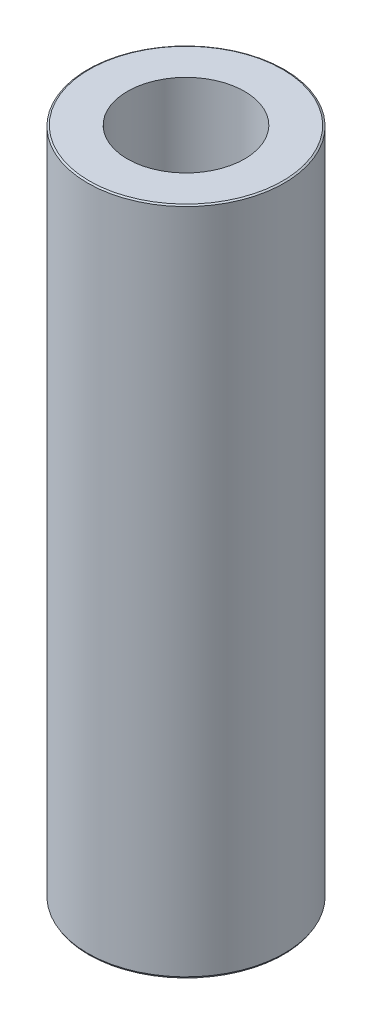
from build123d import *
from OCP.BRepFilletAPI import BRepFilletAPI_MakeChamfer

# Parameters (mm, degrees)
SKETCH1_R           = 42.5
BOSS_EXTRUDE1_DEPTH = 289.378602009
SKETCH2_R           = 25.323627817
CUT_EXTRUDE1_DEPTH  = 296.554521706
CHAMFER1_SIZE       = 0.420189699
CHAMFER1_SIZE2      = 0.727789907


with BuildPart() as part:
    # Sketch1 → Boss-Extrude1 (new body)
    with BuildSketch(Plane(origin=(0, 0, 0), x_dir=(1, 0, 0), z_dir=(0, 1, 0))):
        Circle(SKETCH1_R)
    extrude(amount=BOSS_EXTRUDE1_DEPTH)

    # Sketch2 → Cut-Extrude1 (cut, through all)
    with BuildSketch(Plane(origin=(0, 0, 0), x_dir=(1, 0, 0), z_dir=(0, 1, 0))):
        Circle(SKETCH2_R)
    extrude(amount=CUT_EXTRUDE1_DEPTH, mode=Mode.SUBTRACT)

    # Chamfer1: one chamfer whose edges measure the first distance from different faces: ONE call of the kernel's chamfer builder (chamfer() names one face for all edges)
    chamfer1_edges_1 = [part.edges().sort_by_distance(p)[0] for p in [
        (-42.5, 289.378602009, 0),
    ]]
    chamfer1_side_1 = [part.faces().sort_by_distance(p)[0] for p in [
        (-42.5, 144.689301005, 0),
    ]]
    chamfer1_edges_2 = [part.edges().sort_by_distance(p)[0] for p in [
        (-42.5, 0, 0),
    ]]
    chamfer1_side_2 = [part.faces().sort_by_distance(p)[0] for p in [
        (-41.297918472, 0, 0),
    ]]
    chamfer1 = BRepFilletAPI_MakeChamfer(part.part.solid().wrapped)
    for e in chamfer1_edges_1:
        chamfer1.Add(CHAMFER1_SIZE, CHAMFER1_SIZE2, e.wrapped, chamfer1_side_1[0].wrapped)  # the first distance lies on this face
    for e in chamfer1_edges_2:
        chamfer1.Add(CHAMFER1_SIZE, CHAMFER1_SIZE2, e.wrapped, chamfer1_side_2[0].wrapped)  # the first distance lies on this face
    add(Compound.cast(chamfer1.Shape()), mode=Mode.REPLACE)


solid = part.part
